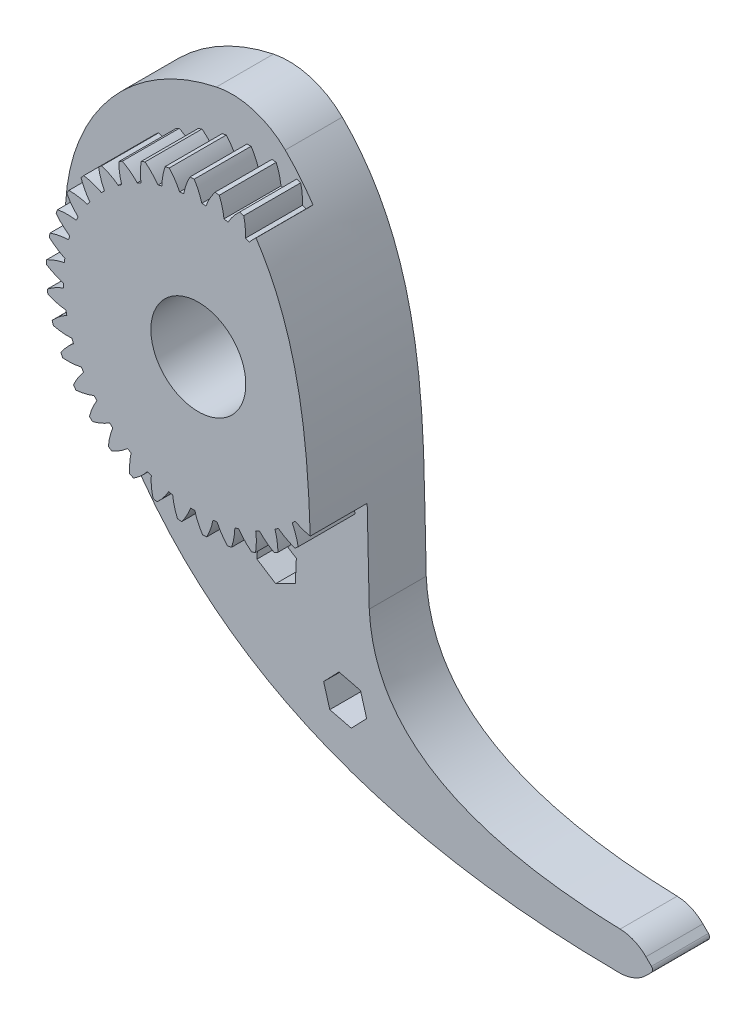
from build123d import *

# Parameters (mm, degrees)
CROQUIS1_R              = 10
SALIENTE_EXTRUIR1_DEPTH = 100
CORTAR_EXTRUIR4_DEPTH   = 15
CROQUIS6_W              = 251.16953667
CROQUIS6_H              = 379.695084619
CORTAR_EXTRUIR6_DEPTH   = 70
CAVIDAD1_START          = 15
CAVIDAD1_DEPTH          = 9.15
CAVIDAD1_START_2        = 24.15
CAVIDAD1_2_OUTLINE_R    = 3.03
CAVIDAD1_2_DEPTH        = 5.85
CROQUIS7_R              = 12.5
CORTAR_EXTRUIR7_DEPTH   = 30
CROQUIS8_R              = 21
CORTAR_EXTRUIR8_DEPTH   = 8
CORTAR_EXTRUIR9_START   = -8
CROQUIS9_R              = 21
CORTAR_EXTRUIR9_DEPTH   = 8
SALIENTE_EXTRUIR2_START = 8
CROQUIS10_R             = 21
CROQUIS10_R_2           = 12.5
SALIENTE_EXTRUIR2_DEPTH = 8
CAVIDAD2_START          = 21.88
CAVIDAD2_OUTLINE_R      = 21.63
CAVIDAD2_DEPTH          = 8.12


# Read off the part's stored shape, not the designer's step: Cavidad1, Cavidad2
with BuildPart() as part:
    # Croquis1 → Saliente-Extruir1 (new body)
    with BuildSketch(Plane.XY):
        with BuildLine():
            Line((102.84709295, -92.84709295), (104.292893219, -94.292893219))
            ThreePointArc((104.292893219, -94.292893219), (104.585786438, -95), (104.292893219, -95.707106781))
            Line((104.292893219, -95.707106781), (102.924090823, -97.075909177))
            ThreePointArc((102.924090823, -97.075909177), (99.655924863, -99.253513567), (95.801242309, -100.004707302))
            add(Edge.make_bspline(
                [(-49.58600728, -2.205776949), (-47.044709507, -15.23286343), (-27.045253615, -73.563310407), (28.636670051, -99.656919769), (95.801242309, -100.004707302)],
                knots=[0.011039812, 0.011039812, 0.011039812, 0.011039812, 0.207725041, 0.983937689, 0.983937689, 0.983937689, 0.983937689], degree=3))
            ThreePointArc((-49.58600728, -2.205776949), (-49.90808847, 0.239585929), (-49.92672205, 2.705998037))
            ThreePointArc((-49.92672205, 2.705998037), (-37.935964584, 32.570885635), (-10.229250857, 48.942439936))
            ThreePointArc((-10.229250857, 48.942439936), (-0.503550938, 48.555514737), (7.88775097, 43.623476385))
            add(Edge.make_bspline(
                [(30, -50), (29.065577858, -23.91659264), (31.451883129, 15.353668912), (10.5535399, 41.001196903), (7.88775097, 43.623476385)],
                knots=[0, 0, 0, 0, 0.805376889, 0.908560603, 0.908560603, 0.908560603, 0.908560603], degree=3))
            add(Edge.make_bspline(
                [(96.061432126, -89.922234449), (74.639632489, -89.310592156), (42.207594165, -82.045244121), (30.598677739, -62.69576919), (30, -50)],
                knots=[0.027764728, 0.027764728, 0.027764728, 0.027764728, 0.487449894, 0.947135059, 0.947135059, 0.947135059, 0.947135059], degree=3))
            ThreePointArc((96.061432126, -89.922234449), (99.734323975, -90.734922209), (102.84709295, -92.84709295))
        make_face()
        Circle(CROQUIS1_R, mode=Mode.SUBTRACT)
    extrude(amount=SALIENTE_EXTRUIR1_DEPTH)

    # Croquis2 → Cortar-Extruir4 (cut)
    with BuildSketch(Plane(origin=(0, 0, 0), x_dir=(-1, 0, 0), z_dir=(0, 0, -1))):
        with BuildLine():
            ThreePointArc((1.102623365, 39.984799883), (1.653330869, 39.965816607), (2.203724614, 39.939248839))
            ThreePointArc((2.203724614, 39.939248839), (3.208029629, 37.678468026), (3.853201686, 35.290265468))
            ThreePointArc((3.853201686, 35.290265468), (4.391380959, 35.227344113), (4.928537187, 35.156215968))
            ThreePointArc((4.928537187, 35.156215968), (6.140272041, 37.312939662), (7.668866774, 39.257973488))
            ThreePointArc((7.668866774, 39.257973488), (8.208938801, 39.148605643), (8.747452981, 39.031808392))
            ThreePointArc((8.747452981, 39.031808392), (9.365948293, 36.63655851), (9.609235823, 34.174736091))
            ThreePointArc((9.609235823, 34.174736091), (10.129718517, 34.024091505), (10.647841327, 33.865520446))
            ThreePointArc((10.647841327, 33.865520446), (12.198034749, 35.793384238), (14.025923488, 37.460291914))
            ThreePointArc((14.025923488, 37.460291914), (14.540628281, 37.263522769), (15.052573634, 37.05968196))
            ThreePointArc((15.052573634, 37.05968196), (15.268388303, 34.595299183), (15.103155055, 32.127009001))
            ThreePointArc((15.103155055, 32.127009001), (15.591743761, 31.892750375), (16.076700112, 31.651061807))
            ThreePointArc((16.076700112, 31.651061807), (17.923066867, 33.297478598), (20.000389573, 34.640791229))
            ThreePointArc((20.000389573, 34.640791229), (20.475687326, 34.361988134), (20.947099317, 34.076664012))
            ThreePointArc((20.947099317, 34.076664012), (20.754346482, 31.610370276), (20.18509959, 29.202940855))
            ThreePointArc((20.18509959, 29.202940855), (20.628466879, 28.891458153), (21.067028427, 28.57324471))
            ThreePointArc((21.067028427, 28.57324471), (23.159204443, 29.893304542), (25.429297167, 30.87638006))
            ThreePointArc((25.429297167, 30.87638006), (25.852222997, 30.523148037), (26.270242736, 30.164123501))
            ThreePointArc((26.270242736, 30.164123501), (25.674180192, 27.763192871), (24.716447225, 25.482292608))
            ThreePointArc((24.716447225, 25.482292608), (25.102499195, 25.102082267), (25.482703124, 24.716023982))
            ThreePointArc((25.482703124, 24.716023982), (27.763619294, 25.673719065), (30.164559823, 26.269741732))
            ThreePointArc((30.164559823, 26.269741732), (30.523577417, 25.85171603), (30.876802415, 25.428784332))
            ThreePointArc((30.876802415, 25.428784332), (29.893689193, 23.158707937), (28.573594612, 21.066553846))
            ThreePointArc((28.573594612, 21.066553846), (28.891800771, 20.627987013), (29.203276108, 20.18461455))
            ThreePointArc((29.203276108, 20.18461455), (31.610714984, 20.753821458), (34.077011921, 20.94653333))
            ThreePointArc((34.077011921, 20.94653333), (34.362328213, 20.4751166), (34.641123413, 19.999814215))
            ThreePointArc((34.641123413, 19.999814215), (33.297776281, 17.922513822), (31.651328823, 16.076174412))
            ThreePointArc((31.651328823, 16.076174412), (31.893009337, 15.591214047), (32.127259848, 15.102621451))
            ThreePointArc((32.127259848, 15.102621451), (34.595552773, 15.267813702), (37.059931966, 15.051958102))
            ThreePointArc((37.059931966, 15.051958102), (37.263764272, 14.540009363), (37.460524868, 14.025301302))
            ThreePointArc((37.460524868, 14.025301302), (35.793586832, 12.197440249), (33.865697293, 10.647278847))
            ThreePointArc((33.865697293, 10.647278847), (34.024259747, 10.129153404), (34.174895688, 9.608668207))
            ThreePointArc((34.174895688, 9.608668207), (36.636714066, 9.365339789), (39.031953674, 8.746804694))
            ThreePointArc((39.031953674, 8.746804694), (39.148741981, 8.208288574), (39.258100856, 7.668214731))
            ThreePointArc((39.258100856, 7.668214731), (37.313041641, 6.139652303), (35.156297822, 4.927953271))
            ThreePointArc((35.156297822, 4.927953271), (35.227417046, 4.390795861), (35.290329461, 3.852615543))
            ThreePointArc((35.290329461, 3.852615543), (37.678521304, 3.20740382), (39.939285436, 2.203061256))
            ThreePointArc((39.939285436, 2.203061256), (39.965844062, 1.65266707), (39.984818192, 1.101959251))
            ThreePointArc((39.984818192, 1.101959251), (37.814693942, -0.085609353), (35.487926192, -0.925794025))
            ThreePointArc((35.487926192, -0.925794025), (35.469662238, -1.467331147), (35.443135042, -2.00852643))
            ThreePointArc((35.443135042, -2.00852643), (37.692556701, -3.038021764), (39.757177604, -4.400775951))
            ThreePointArc((39.757177604, -4.400775951), (39.692782099, -4.948034883), (39.620853919, -5.494354805))
            ThreePointArc((39.620853919, -5.494354805), (37.284859968, -6.308535809), (34.851536446, -6.754288072))
            ThreePointArc((34.851536446, -6.754288072), (34.744387508, -7.285433186), (34.629144292, -7.814881038))
            ThreePointArc((34.629144292, -7.814881038), (36.678437409, -9.200578033), (38.490597607, -10.884571461))
            ThreePointArc((38.490597607, -10.884571461), (38.337004513, -11.413767343), (38.176136036, -11.940797184))
            ThreePointArc((38.176136036, -11.940797184), (35.737992209, -12.359381853), (33.264487636, -12.398542748))
            ThreePointArc((33.264487636, -12.398542748), (33.071376458, -12.904807599), (32.870560757, -13.408066063))
            ThreePointArc((32.870560757, -13.408066063), (34.663825958, -15.112166519), (36.174094444, -17.071464236))
            ThreePointArc((36.174094444, -17.071464236), (35.935493381, -17.568161984), (35.690072679, -18.061525743))
            ThreePointArc((35.690072679, -18.061525743), (33.216285184, -18.073096179), (30.770070318, -17.704597499))
            ThreePointArc((30.770070318, -17.704597499), (30.496264469, -18.172172502), (30.215354012, -18.635513998))
            ThreePointArc((30.215354012, -18.635513998), (31.703675696, -20.611534496), (32.870856284, -22.792691969))
            ThreePointArc((32.870856284, -22.792691969), (32.553755666, -23.243342962), (32.230477177, -23.689582963))
            ThreePointArc((32.230477177, -23.689582963), (29.788524487, -23.293823554), (27.436325694, -22.527716982))
            ThreePointArc((27.436325694, -22.527716982), (27.089293883, -22.94384791), (26.735951175, -23.35463369))
            ThreePointArc((26.735951175, -23.35463369), (27.878731807, -25.548673542), (28.670986852, -27.89219448))
            ThreePointArc((28.670986852, -27.89219448), (28.284036357, -28.284506136), (27.891718275, -28.671450114))
            ThreePointArc((27.891718275, -28.671450114), (25.548210496, -27.879156145), (23.354189625, -26.736339072))
            ThreePointArc((23.354189625, -26.736339072), (22.943397976, -27.089674957), (22.527261285, -27.436699856))
            ThreePointArc((22.527261285, -27.436699856), (23.293328789, -29.788911374), (23.689047639, -32.230870636))
            ThreePointArc((23.689047639, -32.230870636), (23.242802268, -32.554141714), (22.792146008, -32.871234847))
            ThreePointArc((22.792146008, -32.871234847), (20.611007921, -31.704018032), (18.635012143, -30.215663528))
            ThreePointArc((18.635012143, -30.215663528), (18.171665982, -30.496566289), (17.704086432, -30.770364373))
            ThreePointArc((17.704086432, -30.770364373), (18.072544482, -33.216585358), (18.060932958, -35.690372661))
            ThreePointArc((18.060932958, -35.690372661), (17.567565123, -35.935785168), (17.070863412, -36.174377982))
            ThreePointArc((17.070863412, -36.174377982), (15.111590779, -34.664076954), (13.407520108, -32.870783449))
            ThreePointArc((13.407520108, -32.870783449), (12.90425831, -33.071590791), (12.397990251, -33.264693561))
            ThreePointArc((12.397990251, -33.264693561), (12.358788274, -35.738197483), (11.940163108, -38.176334357))
            ThreePointArc((11.940163108, -38.176334357), (11.413130596, -38.337194081), (10.883932163, -38.490778385))
            ThreePointArc((10.883932163, -38.490778385), (9.199968834, -36.678590218), (7.814305875, -34.629274085))
            ThreePointArc((7.814305875, -34.629274085), (7.28485611, -34.744508508), (6.753709216, -34.851648624))
            ThreePointArc((6.753709216, -34.851648624), (6.307916538, -37.284964743), (5.493696735, -39.62094517))
            ThreePointArc((5.493696735, -39.62094517), (4.947375618, -39.692864277), (4.400115616, -39.757250692))
            ThreePointArc((4.400115616, -39.757250692), (3.037395721, -37.692607155), (2.007937749, -35.443168397))
            ThreePointArc((2.007937749, -35.443168397), (1.466742025, -35.469686605), (0.9252046, -35.487941564))
            ThreePointArc((0.9252046, -35.487941564), (0.084981283, -37.814695359), (-1.102623365, -39.984799883))
            ThreePointArc((-1.102623365, -39.984799883), (-1.653330869, -39.965816607), (-2.203724614, -39.939248839))
            ThreePointArc((-2.203724614, -39.939248839), (-3.208029629, -37.678468026), (-3.853201686, -35.290265468))
            ThreePointArc((-3.853201686, -35.290265468), (-4.391380959, -35.227344113), (-4.928537187, -35.156215968))
            ThreePointArc((-4.928537187, -35.156215968), (-6.140272041, -37.312939662), (-7.668866774, -39.257973488))
            ThreePointArc((-7.668866774, -39.257973488), (-8.208938801, -39.148605643), (-8.747452981, -39.031808392))
            ThreePointArc((-8.747452981, -39.031808392), (-9.365948293, -36.63655851), (-9.609235823, -34.174736091))
            ThreePointArc((-9.609235823, -34.174736091), (-10.129718517, -34.024091505), (-10.647841327, -33.865520446))
            ThreePointArc((-10.647841327, -33.865520446), (-12.198034749, -35.793384238), (-14.025923488, -37.460291914))
            ThreePointArc((-14.025923488, -37.460291914), (-14.540628281, -37.263522769), (-15.052573634, -37.05968196))
            ThreePointArc((-15.052573634, -37.05968196), (-15.268388303, -34.595299183), (-15.103155055, -32.127009001))
            ThreePointArc((-15.103155055, -32.127009001), (-15.591743761, -31.892750375), (-16.076700112, -31.651061807))
            ThreePointArc((-16.076700112, -31.651061807), (-17.923066867, -33.297478598), (-20.000389573, -34.640791229))
            ThreePointArc((-20.000389573, -34.640791229), (-20.475687326, -34.361988134), (-20.947099317, -34.076664012))
            ThreePointArc((-20.947099317, -34.076664012), (-20.754346482, -31.610370276), (-20.18509959, -29.202940855))
            ThreePointArc((-20.18509959, -29.202940855), (-20.628466879, -28.891458153), (-21.067028427, -28.57324471))
            ThreePointArc((-21.067028427, -28.57324471), (-23.159204443, -29.893304542), (-25.429297167, -30.87638006))
            ThreePointArc((-25.429297167, -30.87638006), (-25.852222997, -30.523148037), (-26.270242736, -30.164123501))
            ThreePointArc((-26.270242736, -30.164123501), (-25.674180192, -27.763192871), (-24.716447225, -25.482292608))
            ThreePointArc((-24.716447225, -25.482292608), (-25.102499195, -25.102082267), (-25.482703124, -24.716023982))
            ThreePointArc((-25.482703124, -24.716023982), (-27.421409872, -25.555856409), (-29.453588357, -26.133916065))
            add(Edge.make_bspline(
                [(-30, -50), (-29.734872846, -42.599255467), (-29.715262914, -34.495945215), (-29.453588357, -26.133916065)],
                knots=[0, 0, 0, 0, 0.228512653, 0.228512653, 0.228512653, 0.228512653], degree=3))
            add(Edge.make_bspline(
                [(-96.061432126, -89.922234449), (-74.639632489, -89.310592156), (-42.207594165, -82.045244121), (-30.598677739, -62.69576919), (-30, -50)],
                knots=[0.027764728, 0.027764728, 0.027764728, 0.027764728, 0.487449894, 0.947135059, 0.947135059, 0.947135059, 0.947135059], degree=3))
            ThreePointArc((-96.061432126, -89.922234449), (-99.734323975, -90.734922209), (-102.84709295, -92.84709295))
            Line((-102.84709295, -92.84709295), (-104.292893219, -94.292893219))
            ThreePointArc((-104.292893219, -94.292893219), (-104.585786438, -95), (-104.292893219, -95.707106781))
            Line((-104.292893219, -95.707106781), (-102.924090823, -97.075909177))
            ThreePointArc((-102.924090823, -97.075909177), (-99.655924863, -99.253513567), (-95.801242309, -100.004707302))
            add(Edge.make_bspline(
                [(49.58600728, -2.205776949), (47.044709507, -15.23286343), (27.045253615, -73.563310407), (-28.636670051, -99.656919769), (-95.801242309, -100.004707302)],
                knots=[0.011039812, 0.011039812, 0.011039812, 0.011039812, 0.207725041, 0.983937689, 0.983937689, 0.983937689, 0.983937689], degree=3))
            ThreePointArc((49.58600728, -2.205776949), (49.90808847, 0.239585929), (49.92672205, 2.705998037))
            ThreePointArc((49.92672205, 2.705998037), (37.935964584, 32.570885635), (10.229250857, 48.942439936))
            ThreePointArc((10.229250857, 48.942439936), (0.503550938, 48.555514737), (-7.88775097, 43.623476385))
            add(Edge.make_bspline(
                [(-15.182020199, 34.727214957), (-15.121605489, 34.818294405), (-12.99668952, 38.002837294), (-10.5535399, 41.001196903), (-7.88775097, 43.623476385)],
                knots=[0.802344073, 0.802344073, 0.802344073, 0.802344073, 0.805376889, 0.908560603, 0.908560603, 0.908560603, 0.908560603], degree=3))
            ThreePointArc((-15.182020199, 34.727214957), (-14.257602386, 33.834526615), (-13.407520108, 32.870783449))
            ThreePointArc((-13.407520108, 32.870783449), (-12.90425831, 33.071590791), (-12.397990251, 33.264693561))
            ThreePointArc((-12.397990251, 33.264693561), (-12.358788274, 35.738197483), (-11.940163108, 38.176334357))
            ThreePointArc((-11.940163108, 38.176334357), (-11.413130596, 38.337194081), (-10.883932163, 38.490778385))
            ThreePointArc((-10.883932163, 38.490778385), (-9.199968834, 36.678590218), (-7.814305875, 34.629274085))
            ThreePointArc((-7.814305875, 34.629274085), (-7.28485611, 34.744508508), (-6.753709216, 34.851648624))
            ThreePointArc((-6.753709216, 34.851648624), (-6.307916538, 37.284964743), (-5.493696735, 39.62094517))
            ThreePointArc((-5.493696735, 39.62094517), (-4.947375618, 39.692864277), (-4.400115616, 39.757250692))
            ThreePointArc((-4.400115616, 39.757250692), (-3.037395721, 37.692607155), (-2.007937749, 35.443168397))
            ThreePointArc((-2.007937749, 35.443168397), (-1.466742025, 35.469686605), (-0.9252046, 35.487941564))
            ThreePointArc((-0.9252046, 35.487941564), (-0.084981283, 37.814695359), (1.102623365, 39.984799883))
        make_face()
    extrude(amount=-CORTAR_EXTRUIR4_DEPTH, mode=Mode.SUBTRACT)

    # Croquis6 → Cortar-Extruir6 (cut)
    with BuildSketch(Plane.XY.offset(100)):
        with Locations((7.868696645, -20.070047355)):
            Rectangle(CROQUIS6_W, CROQUIS6_H)
    extrude(amount=-CORTAR_EXTRUIR6_DEPTH, mode=Mode.SUBTRACT)

    # Cavidad1 outline → Cavidad1 (cut)
    with BuildSketch(Plane.XY.offset(CAVIDAD1_START)):
        Polygon((5.355014557, -56.526622248), (10.533194498, -53.84524465), (10.800143352, -48.020120476), (5.888912264, -44.8763739), (0.710732322, -47.557751499), (0.443783468, -53.382875673), align=None)
        Polygon((25.270793802, -79.515653596), (29.312393262, -75.312225574), (27.692917543, -69.710383759), (22.031842363, -68.311969965), (17.990242902, -72.515397986), (19.609718622, -78.117239802), align=None)
    extrude(amount=CAVIDAD1_DEPTH, mode=Mode.SUBTRACT)

    # Cavidad1 2 outline → Cavidad1 2 (cut)
    with BuildSketch(Plane.XY.offset(CAVIDAD1_START_2)):
        with Locations((5.62196341, -50.701498074)):
            Circle(CAVIDAD1_2_OUTLINE_R)
        with Locations((23.651318082, -73.91381178)):
            Circle(CAVIDAD1_2_OUTLINE_R)
    extrude(amount=CAVIDAD1_2_DEPTH, mode=Mode.SUBTRACT)

    # Croquis7 → Cortar-Extruir7 (cut)
    with BuildSketch(Plane(origin=(0, 0, 0), x_dir=(-1, 0, 0), z_dir=(0, 0, -1))):
        Circle(CROQUIS7_R)
    extrude(amount=-CORTAR_EXTRUIR7_DEPTH, mode=Mode.SUBTRACT)

    # Croquis8 → Cortar-Extruir8 (cut)
    with BuildSketch(Plane(origin=(0, 0, 0), x_dir=(-1, 0, 0), z_dir=(0, 0, -1))):
        Circle(CROQUIS8_R)
    extrude(amount=-CORTAR_EXTRUIR8_DEPTH, mode=Mode.SUBTRACT)

    # Croquis9 → Cortar-Extruir9 (cut)
    with BuildSketch(Plane.XY.offset(30).offset(CORTAR_EXTRUIR9_START)):
        with Locations(Location((0, 0, 0), (0, 0, 180))):
            Circle(CROQUIS9_R)
    extrude(amount=CORTAR_EXTRUIR9_DEPTH, mode=Mode.SUBTRACT)

    # Croquis10 → Saliente-Extruir2 (add)
    with BuildSketch(Plane(origin=(0, 0, 8), x_dir=(-1, 0, 0), z_dir=(0, 0, -1)).offset(SALIENTE_EXTRUIR2_START)):
        with Locations(Location((0, 0, 0), (0, 0, 180))):
            Circle(CROQUIS10_R)
        Circle(CROQUIS10_R_2, mode=Mode.SUBTRACT)
    extrude(amount=-SALIENTE_EXTRUIR2_DEPTH)

    # Cavidad2 outline → Cavidad2 (cut)
    with BuildSketch(Plane.XY.offset(CAVIDAD2_START)):
        Circle(CAVIDAD2_OUTLINE_R)
    extrude(amount=CAVIDAD2_DEPTH, mode=Mode.SUBTRACT)


with BuildPart() as body_2:
    # Simetría1: mirrored copy
    add(part.part.mirror(Plane(origin=(47.41337464, -79.024212397, 0), x_dir=(1, 0, 0), z_dir=(0, 0, 1))))


solid = body_2.part
